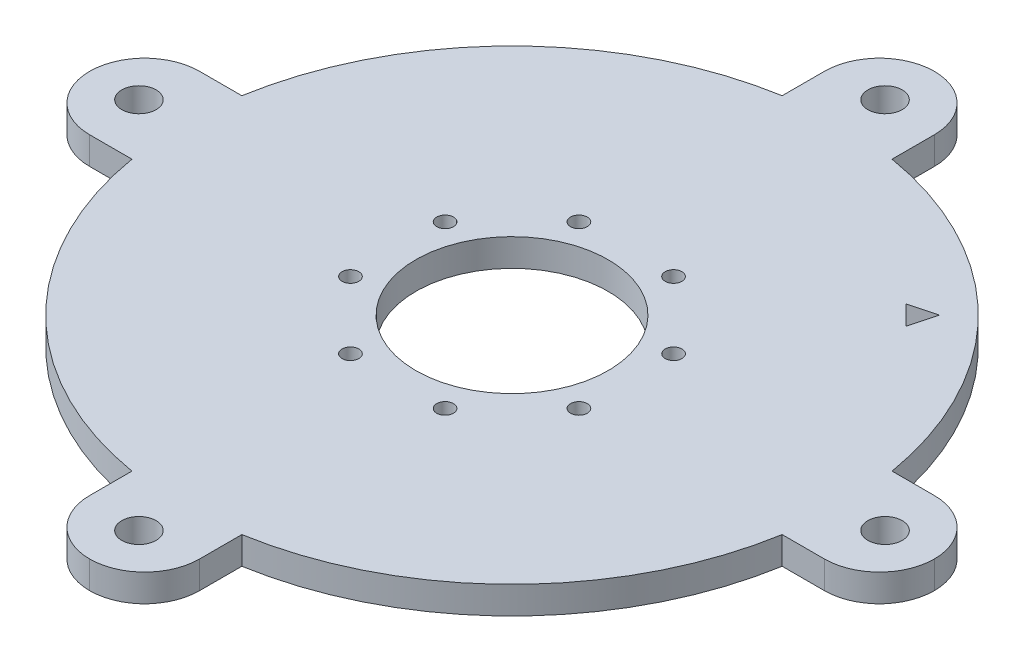
from build123d import *

# Parameters (mm, degrees)
SKETCH1_R           = 155
BOSS_EXTRUDE1_DEPTH = 10
SKETCH2_R           = 6.25
CUT_EXTRUDE1_DEPTH  = 220.431082575
SKETCH3_R           = 35
CUT_EXTRUDE2_DEPTH  = 220.431082575
SKETCH4_R           = 3.05
CUT_EXTRUDE3_DEPTH  = 220.431082575
CIRPATTERN1_COUNT   = 8
CUT_EXTRUDE4_START  = -10
CUT_EXTRUDE4_DEPTH  = 10
CIRPATTERN3_COUNT   = 4
FILLET1_R           = 20
CUT_EXTRUDE5_DEPTH  = 218.60055147


with BuildPart() as part:
    # Sketch1 → Boss-Extrude1 (new body)
    with BuildSketch(Plane(origin=(0, 0, 0), x_dir=(1, 0, 0), z_dir=(0, 1, 0))):
        with Locations(Location((0, 0, 0), (0, 0, 270))):
            Circle(SKETCH1_R)
    extrude(amount=BOSS_EXTRUDE1_DEPTH)

    # Sketch2 → Cut-Extrude1 (cut, through all)
    with BuildSketch(Plane(origin=(0, 10, 0), x_dir=(1, 0, 0), z_dir=(0, 1, 0))):
        with Locations(Location((-135.764501988, 0, 0), (0, 0, 270))):
            Circle(SKETCH2_R)
        with Locations(Location((0, -135.764501988, 0), (0, 0, 270))):
            Circle(SKETCH2_R)
        with Locations(Location((135.764501988, 0, 0), (0, 0, 270))):
            Circle(SKETCH2_R)
        with Locations(Location((0, 135.764501988, 0), (0, 0, 270))):
            Circle(SKETCH2_R)
    extrude(amount=-CUT_EXTRUDE1_DEPTH, mode=Mode.SUBTRACT)

    # Sketch3 → Cut-Extrude2 (cut, through all)
    with BuildSketch(Plane(origin=(0, 10, 0), x_dir=(1, 0, 0), z_dir=(0, 1, 0))):
        with Locations(Location((0, 0, 0), (0, 0, 270))):
            Circle(SKETCH3_R)
    extrude(amount=-CUT_EXTRUDE2_DEPTH, mode=Mode.SUBTRACT)

    # Sketch4 → Cut-Extrude3 (cut, through all)
    with BuildSketch(Plane(origin=(0, 10, 0), x_dir=(1, 0, 0), z_dir=(0, 1, 0))):
        with Locations(Location((17.220754456, 41.574578963, 0), (0, 0, 270))):
            Circle(SKETCH4_R)
    cut_extrude3 = extrude(amount=-CUT_EXTRUDE3_DEPTH, mode=Mode.SUBTRACT)

    # CirPattern1: Cut-Extrude3 ×8 about axis
    cirpattern1_axis = Axis((0, 0, 0), (0, 1, 0))
    for i in range(1, CIRPATTERN1_COUNT):
        add(cut_extrude3.rotate(cirpattern1_axis, i * 360 / CIRPATTERN1_COUNT), mode=Mode.SUBTRACT)

    # Sketch5 → Cut-Extrude4 (cut)
    with BuildSketch(Plane(origin=(0, 10, 0), x_dir=(1, 0, 0), z_dir=(0, 1, 0)).offset(CUT_EXTRUDE4_START)):
        with BuildLine():
            Line((-153.704261489, 20), (-118.321595662, 20))
            ThreePointArc((-118.321595662, 20), (-84.852813742, 84.852813742), (-20, 118.321595662))
            Line((-20, 118.321595662), (-20, 153.704261489))
            ThreePointArc((-20, 153.704261489), (-109.601551084, 109.601551084), (-153.704261489, 20))
        make_face()
        with BuildLine():
            Line((-153.704261489, -20), (-153.704261489, 20))
            ThreePointArc((-153.704261489, 20), (-155, 0), (-153.704261489, -20))
        make_face()
    cut_extrude4 = extrude(amount=CUT_EXTRUDE4_DEPTH, mode=Mode.SUBTRACT)

    # CirPattern3: Cut-Extrude4 ×4 about axis
    cirpattern3_axis = Axis((0, 0, 0), (0, 1, 0))
    for i in range(1, CIRPATTERN3_COUNT):
        add(cut_extrude4.rotate(cirpattern3_axis, i * 360 / CIRPATTERN3_COUNT), mode=Mode.SUBTRACT)

    # Fillet1
    fillet1_edges = [part.edges().sort_by_distance(p)[0] for p in [
        (-153.704261489, 5, -20),
        (-20, 5, 153.704261489),
        (153.704261489, 5, 20),
        (20, 5, -153.704261489),
        (-153.704261489, 5, 20),
        (20, 5, 153.704261489),
        (153.704261489, 5, -20),
        (-20, 5, -153.704261489),
    ]]
    fillet(fillet1_edges, radius=FILLET1_R - 0.0001)  # a hair under: the kernel refuses the full size

    # Sketch6 → Cut-Extrude5 (cut, through all)
    with BuildSketch(Plane(origin=(0, 10, 0), x_dir=(1, 0, 0), z_dir=(0, 1, 0))):
        Polygon((77.781745931, 77.781745931), (68.122487668, 75.193555479), (75.193555479, 68.122487668), align=None)
    extrude(amount=-CUT_EXTRUDE5_DEPTH, mode=Mode.SUBTRACT)


solid = part.part
